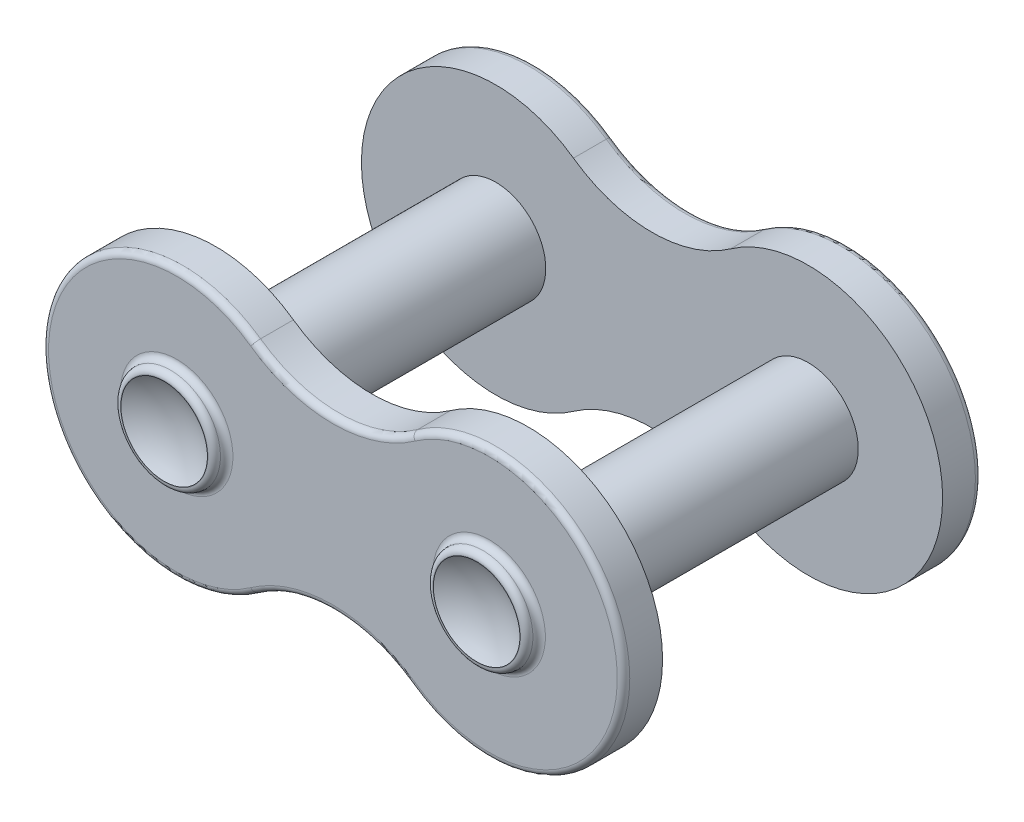
from build123d import *

# Parameters (mm, degrees)
SKETCH1_R           = 2.032
BOSS_EXTRUDE1_DEPTH = 1.5875
BOSS_EXTRUDE2_START = 0.508
SKETCH2_R           = 2.032
BOSS_EXTRUDE2_DEPTH = 15.573248
FILLET1_R           = 0.254
FILLET2_R           = 0.254


with BuildPart() as part:
    # Sketch1 → Boss-Extrude1 (new body)
    with BuildSketch(Plane.XY):
        with BuildLine():
            ThreePointArc((3.193488118, -4.456338602), (11.811, 0), (3.193488118, 4.456338602))
            ThreePointArc((3.193488118, 4.456338602), (0, 3.439908329), (-3.193488118, 4.456338602))
            ThreePointArc((-3.193488118, 4.456338602), (-11.811, 0), (-3.193488118, -4.456338602))
            ThreePointArc((-3.193488118, -4.456338602), (0, -3.439908329), (3.193488118, -4.456338602))
        make_face()
        with Locations((6.35, 0)):
            Circle(SKETCH1_R, mode=Mode.SUBTRACT)
        with Locations(Location((-6.35, 0, 0), (0, 0, 180))):
            Circle(SKETCH1_R, mode=Mode.SUBTRACT)
    boss_extrude1 = extrude(amount=BOSS_EXTRUDE1_DEPTH)

    # Sketch2 → Boss-Extrude2 (add)
    with BuildSketch(Plane(origin=(0, 0, 0), x_dir=(-1, 0, 0), z_dir=(0, 0, -1)).offset(BOSS_EXTRUDE2_START)):
        with Locations(Location((6.35, 0, 0), (0, 0, 180))):
            Circle(SKETCH2_R)
    boss_extrude2 = extrude(amount=-BOSS_EXTRUDE2_DEPTH)

    # Mirror1: Boss-Extrude1 across plane
    add(boss_extrude1.mirror(Plane(origin=(0, 0, 7.278624), x_dir=(1, 0, 0), z_dir=(0, 0, -1))))

    # Sketch3 → Cut-Revolve1 (revolve, cut)
    with BuildSketch(Plane(origin=(0, 0, 0), x_dir=(1, 0, 0), z_dir=(0, 1, 0))):
        with BuildLine():
            Line((-6.35, -14.557248), (-6.35, -15.379780772))
            Line((-6.35, -15.379780772), (-8.530698573, -15.379780772))
            ThreePointArc((-8.530698573, -15.379780772), (-7.51533326, -14.769716904), (-6.35, -14.557248))
        make_face()
    cut_revolve1 = revolve(axis=Axis((-6.35, 0, 14.557248), (0, 0, 1)), mode=Mode.SUBTRACT)

    # Mirror2: Boss-Extrude2, Cut-Revolve1 across plane
    add(boss_extrude2.mirror(Plane(origin=(0, 0, 0), x_dir=(0, 0, 1), z_dir=(1, 0, 0))))
    add(cut_revolve1.mirror(Plane(origin=(0, 0, 0), x_dir=(0, 0, 1), z_dir=(1, 0, 0))), mode=Mode.SUBTRACT)

    # Mirror3: Cut-Revolve1 across plane
    add(cut_revolve1.mirror(Plane(origin=(0, 0, 7.278624), x_dir=(1, 0, 0), z_dir=(0, 0, -1))), mode=Mode.SUBTRACT)

    # Mirror4 copy 1 sketch → Mirror4 copy 1 (revolve, cut)
    with BuildSketch(Plane(origin=(0, 0, 14.557248), x_dir=(-1, 0, 0), z_dir=(0, 1, 0))):
        with BuildLine():
            Line((-6.35, -14.557248), (-6.35, -15.379780772))
            Line((-6.35, -15.379780772), (-8.530698573, -15.379780772))
            ThreePointArc((-8.530698573, -15.379780772), (-7.51533326, -14.769716904), (-6.35, -14.557248))
        make_face()
    revolve(axis=Axis((6.35, 0, 0), (0, 0, -1)), mode=Mode.SUBTRACT)

    # Mirror4 copy 2 sketch → Mirror4 copy 2 (revolve, cut)
    with BuildSketch(Plane(origin=(0, 0, 0), x_dir=(-1, 0, 0), z_dir=(0, 1, 0))):
        with BuildLine():
            Line((-6.35, 14.557248), (-6.35, 15.379780772))
            Line((-6.35, 15.379780772), (-8.530698573, 15.379780772))
            ThreePointArc((-8.530698573, 15.379780772), (-7.51533326, 14.769716904), (-6.35, 14.557248))
        make_face()
    revolve(axis=Axis((6.35, 0, 14.557248), (0, 0, -1)), mode=Mode.SUBTRACT)

    # Fillet1
    fillet1_edges = [part.edges().sort_by_distance(p)[0] for p in [
        (-8.382, 0, 15.065248),
        (-8.382, 0, -0.508),
        (8.382, 0, -0.508),
        (8.382, 0, 15.065248),
    ]]
    fillet(fillet1_edges, radius=FILLET1_R)

    # Fillet2
    fillet2_edges = [part.edges().sort_by_distance(p)[0] for p in [
        (-8.382, 0, 0),
        (-8.382, 0, 14.557248),
        (0, 3.439908329, 14.557248),
        (-11.811, 0, 14.557248),
        (0, -3.439908329, 14.557248),
        (11.811, 0, 14.557248),
        (8.382, 0, 14.557248),
        (11.811, 0, 0),
        (8.382, 0, 0),
        (0, -3.439908329, 0),
        (-11.811, 0, 0),
        (0, 3.439908329, 0),
    ]]
    fillet(fillet2_edges, radius=FILLET2_R - 0.0001)  # a hair under: the kernel refuses the full size


solid = part.part
